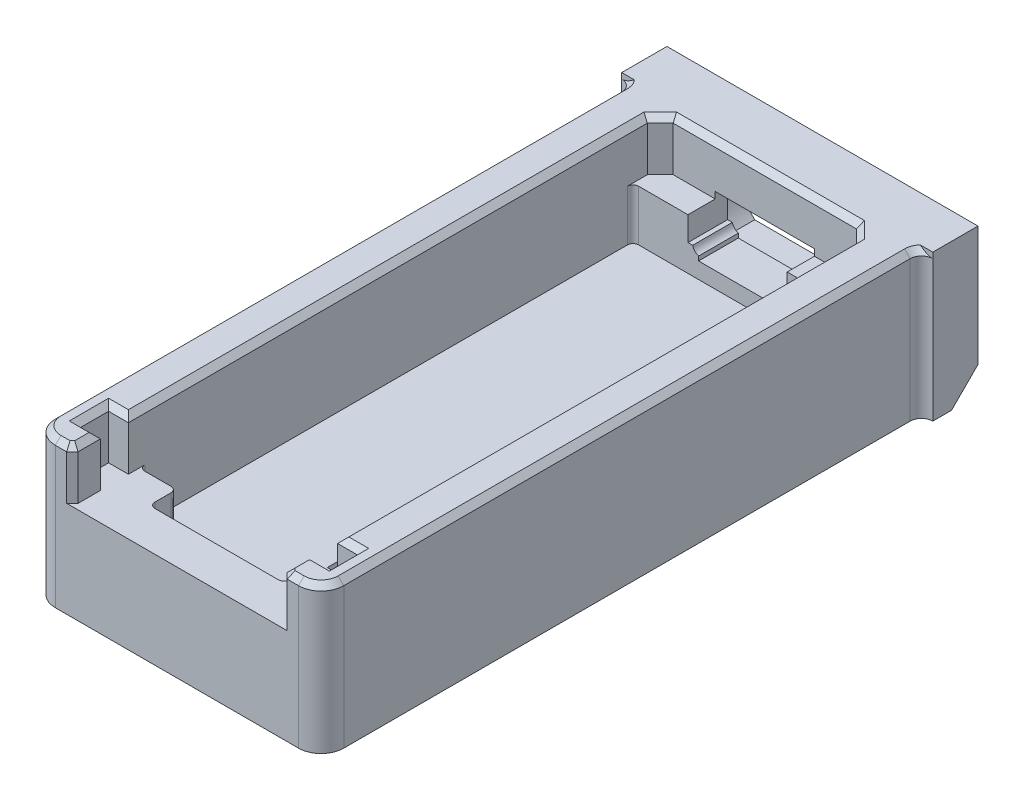
from build123d import *

# Parameters (mm, degrees)
BOSS_EXTRUDE1_DEPTH = 24
SHELL1_T            = -4
FILLET1_R           = 4
CHAMFER1_SIZE       = 2.343145751
SKETCH3_W           = 1
SKETCH3_H           = 1
CUT_EXTRUDE1_DEPTH  = 3.5
CUT_EXTRUDE2_DEPTH  = 4
BOSS_EXTRUDE2_DEPTH = 4.5
BOSS_EXTRUDE5_DEPTH = 3.51
BOSS_EXTRUDE6_DEPTH = 4.45
SKETCH10_W          = 8.78
SKETCH10_H          = 3.872772036
BOSS_EXTRUDE7_DEPTH = 1.1
CHAMFER2_SIZE       = 0.5
SKETCH12_W          = 22.01
SKETCH12_H          = 2.48
CUT_EXTRUDE3_DEPTH  = 4.45
CHAMFER3_SIZE       = 0.5
BOSS_EXTRUDE9_DEPTH = 12.95


with BuildPart() as part:
    # Sketch2 → Boss-Extrude1 (new, symmetric)
    with BuildSketch(Plane(origin=(15.913401445, 30.618542248, 37.090261304), x_dir=(0, 0, 1), z_dir=(1, 0, 0))):
        Polygon((116.226184939, -14.5430724), (116.226184939, 10), (-29.35, 10), (-29.35, -22.172396969), align=None)
    extrude(amount=BOSS_EXTRUDE1_DEPTH, both=True)

    # Shell1
    shell1_openings = [part.faces().sort_by_distance(p)[0] for p in [
        (15.913401445, 48.976276932, 80.528353773),
    ]]
    offset(amount=SHELL1_T, openings=shell1_openings, kind=Kind.INTERSECTION)

    # Fillet1
    fillet1_edges = [part.edges().sort_by_distance(p)[0] for p in [
        (39.913401445, 36.704740732, 7.740261304),
        (-8.086598555, 36.704740732, 7.740261304),
        (-8.086598555, 32.890078447, 153.316446243),
        (39.913401445, 32.890078447, 153.316446243),
    ]]
    fillet(fillet1_edges, radius=FILLET1_R)

    # Chamfer1
    chamfer1_edges = [part.edges().sort_by_distance(p)[0] for p in [
        (15.913401445, 20.618542248, 7.740261304),
        (-8.086598555, 20.618542248, 80.528353773),
        (39.913401445, 20.618542248, 80.528353773),
        (15.913401445, 20.618542248, 153.316446243),
        (38.74182857, 20.618542248, 152.144873368),
        (-6.915025679, 20.618542248, 152.144873368),
        (38.74182857, 20.618542248, 8.911834179),
        (-6.915025679, 20.618542248, 8.911834179),
    ]]
    chamfer(chamfer1_edges, length=CHAMFER1_SIZE)

    # Sketch3 → Cut-Extrude1 (cut)
    with BuildSketch(Plane(origin=(0, 24.618542248, 0), x_dir=(1, 0, 0), z_dir=(0, 1, 0))):
        with Locations((18.603401445, -58.320261304)):
            Rectangle(SKETCH3_W, SKETCH3_H)
        with Locations((21.143401445, -58.320261304)):
            Rectangle(SKETCH3_W, SKETCH3_H)
        with Locations((21.143401445, -55.780261304)):
            Rectangle(SKETCH3_W, SKETCH3_H)
        with Locations((21.143401445, -53.240261304)):
            Rectangle(SKETCH3_W, SKETCH3_H)
        with Locations((18.603401445, -55.780261304)):
            Rectangle(SKETCH3_W, SKETCH3_H)
        with Locations((18.603401445, -53.240261304)):
            Rectangle(SKETCH3_W, SKETCH3_H)
    extrude(amount=-CUT_EXTRUDE1_DEPTH, mode=Mode.SUBTRACT)

    # Sketch4 → Cut-Extrude2 (cut)
    with BuildSketch(Plane(origin=(0, 0, 7.740261304), x_dir=(-1, 0, 0), z_dir=(0, 0, -1))):
        with BuildLine():
            Line((-21.913401445, 31.568542248), (-9.913401445, 31.568542248))
            ThreePointArc((-9.913401445, 31.568542248), (-8.380811265, 27.868542248), (-9.913401445, 24.168542248))
            Line((-9.913401445, 24.168542248), (-21.913401445, 24.168542248))
            ThreePointArc((-21.913401445, 24.168542248), (-23.445991626, 27.868542248), (-21.913401445, 31.568542248))
        make_face()
    extrude(amount=-CUT_EXTRUDE2_DEPTH, mode=Mode.SUBTRACT)

    # Sketch5 → Boss-Extrude2 (add)
    with BuildSketch(Plane(origin=(0, 24.618542248, 0), x_dir=(1, 0, 0), z_dir=(0, 1, 0))):
        with BuildLine():
            Line((11.523401445, -11.740261304), (11.523401445, -15.086474441))
            Line((11.523401445, -15.086474441), (11.523401445, -15.250261304))
            Line((11.523401445, -15.250261304), (7.163401445, -15.250261304))
            ThreePointArc((7.163401445, -15.250261304), (6.809848055, -15.396707913), (6.663401445, -15.750261304))
            Line((6.663401445, -15.750261304), (6.663401445, -58.430261304))
            ThreePointArc((6.663401445, -58.430261304), (6.809848055, -58.783814694), (7.163401445, -58.930261304))
            Line((7.163401445, -58.930261304), (9.463401445, -58.930261304))
            ThreePointArc((9.463401445, -58.930261304), (9.816954836, -59.076707913), (9.963401445, -59.430261304))
            Line((9.963401445, -59.430261304), (9.963401445, -60.840261304))
            ThreePointArc((9.963401445, -60.840261304), (10.109848055, -61.193814694), (10.463401445, -61.340261304))
            Line((10.463401445, -61.340261304), (21.363401445, -61.340261304))
            ThreePointArc((21.363401445, -61.340261304), (21.716954836, -61.193814694), (21.863401445, -60.840261304))
            Line((21.863401445, -60.840261304), (21.863401445, -59.993814694))
            Line((21.863401445, -59.993814694), (22.926954836, -58.930261304))
            Line((22.926954836, -58.930261304), (24.663401445, -58.930261304))
            ThreePointArc((24.663401445, -58.930261304), (25.016954836, -58.783814694), (25.163401445, -58.430261304))
            Line((25.163401445, -58.430261304), (25.163401445, -15.750261304))
            ThreePointArc((25.163401445, -15.750261304), (25.016954836, -15.396707913), (24.663401445, -15.250261304))
            Line((24.663401445, -15.250261304), (20.303401445, -15.250261304))
            Line((20.303401445, -15.250261304), (20.303401445, -15.086474441))
            Line((20.303401445, -15.086474441), (20.303401445, -11.740261304))
            Line((20.303401445, -11.740261304), (29.673401445, -11.740261304))
            ThreePointArc((29.673401445, -11.740261304), (28.966294664, -12.033154523), (28.673401445, -12.740261304))
            Line((28.673401445, -12.740261304), (28.673401445, -62.850261304))
            ThreePointArc((28.673401445, -62.850261304), (28.087615008, -64.264474866), (26.673401445, -64.850261304))
            Line((26.673401445, -64.850261304), (5.153401445, -64.850261304))
            ThreePointArc((5.153401445, -64.850261304), (3.739187883, -64.264474866), (3.153401445, -62.850261304))
            Line((3.153401445, -62.850261304), (3.153401445, -12.740261304))
            ThreePointArc((3.153401445, -12.740261304), (2.860508227, -12.033154523), (2.153401445, -11.740261304))
            Line((2.153401445, -11.740261304), (11.523401445, -11.740261304))
        make_face()
    extrude(amount=BOSS_EXTRUDE2_DEPTH)

    # Sketch7 → Boss-Extrude5 (add)
    with BuildSketch(Plane(origin=(0, 0, 11.740261304), x_dir=(-1, 0, 0), z_dir=(0, 0, -1))):
        with BuildLine():
            Line((-20.303401445, 24.618542248), (-11.523401445, 24.618542248))
            Line((-11.523401445, 24.618542248), (-11.523401445, 26.981314283))
            Line((-11.523401445, 26.981314283), (-11.938804776, 26.981314283))
            ThreePointArc((-11.938804776, 26.981314283), (-12.129593975, 26.634350996), (-12.463401445, 26.421380076))
            Line((-12.463401445, 26.421380076), (-12.463401445, 26.041314283))
            Line((-12.463401445, 26.041314283), (-19.363401445, 26.041314283))
            Line((-19.363401445, 26.041314283), (-19.363401445, 26.421380076))
            ThreePointArc((-19.363401445, 26.421380076), (-19.697208916, 26.634350996), (-19.887998115, 26.981314283))
            Line((-19.887998115, 26.981314283), (-20.303401445, 26.981314283))
            Line((-20.303401445, 26.981314283), (-20.303401445, 24.618542248))
        make_face()
    extrude(amount=-BOSS_EXTRUDE5_DEPTH)

    # Sketch9 → Boss-Extrude6 (add)
    with BuildSketch(Plane(origin=(0, 29.118542248, 0), x_dir=(1, 0, 0), z_dir=(0, 1, 0))):
        with BuildLine():
            Line((28.673401445, -62.850261304), (28.673401445, -12.740261304))
            ThreePointArc((28.673401445, -12.740261304), (28.966294664, -12.033154523), (29.673401445, -11.740261304))
            Line((29.673401445, -11.740261304), (23.294493848, -11.740261304))
            Line((23.294493848, -11.740261304), (20.303401445, -11.740261304))
            Line((20.303401445, -11.740261304), (20.303401445, -12.840261304))
            Line((20.303401445, -12.840261304), (24.016954836, -12.840261304))
            Line((24.016954836, -12.840261304), (25.163401445, -13.986707913))
            Line((25.163401445, -13.986707913), (25.163401445, -60.193814694))
            Line((25.163401445, -60.193814694), (25.163401445, -64.850261304))
            Line((25.163401445, -64.850261304), (26.673401445, -64.850261304))
            ThreePointArc((26.673401445, -64.850261304), (28.087615008, -64.264474866), (28.673401445, -62.850261304))
        make_face()
        with BuildLine():
            Line((11.523401445, -11.740261304), (11.523401445, -12.840261304))
            Line((11.523401445, -12.840261304), (7.809848055, -12.840261304))
            Line((7.809848055, -12.840261304), (6.663401445, -13.986707913))
            Line((6.663401445, -13.986707913), (6.663401445, -60.193814694))
            Line((6.663401445, -60.193814694), (6.663401445, -64.850261304))
            Line((6.663401445, -64.850261304), (5.153401445, -64.850261304))
            ThreePointArc((5.153401445, -64.850261304), (3.739187883, -64.264474866), (3.153401445, -62.850261304))
            Line((3.153401445, -62.850261304), (3.153401445, -12.740261304))
            ThreePointArc((3.153401445, -12.740261304), (2.860508227, -12.033154523), (2.153401445, -11.740261304))
            Line((2.153401445, -11.740261304), (8.532309043, -11.740261304))
            Line((8.532309043, -11.740261304), (11.523401445, -11.740261304))
        make_face()
    extrude(amount=BOSS_EXTRUDE6_DEPTH)

    # Sketch10 → Boss-Extrude7 (add)
    with BuildSketch(Plane(origin=(0, 0, 11.740261304), x_dir=(-1, 0, 0), z_dir=(0, 0, -1))):
        with Locations((-15.913401445, 31.63215623)):
            Rectangle(SKETCH10_W, SKETCH10_H)
    extrude(amount=-BOSS_EXTRUDE7_DEPTH)

    # Chamfer2
    chamfer2_edges = [part.edges().sort_by_distance(p)[0] for p in [
        (6.663401445, 31.343542248, 64.850261304),
        (25.163401445, 31.343542248, 64.850261304),
    ]]
    chamfer(chamfer2_edges, length=CHAMFER2_SIZE)

    # Sketch12 → Cut-Extrude3 (cut)
    with BuildSketch(Plane(origin=(0, 33.568542248, 0), x_dir=(1, 0, 0), z_dir=(0, 1, 0))):
        with Locations((15.913401445, -61.130261304)):
            Rectangle(SKETCH12_W, SKETCH12_H)
    extrude(amount=-CUT_EXTRUDE3_DEPTH, mode=Mode.SUBTRACT)

    # Chamfer3
    # the kernel refuses this chamfer: 0.5 mm, written as the material it takes off along each edge
    with BuildSketch(Plane(origin=(2.153401445, 33.568542248, 12.740261304), x_dir=(1, 0, 0), z_dir=(0, 0, 1))) as chamfer3_piece_1_section:
        Polygon((1, -CHAMFER3_SIZE), (1 + CHAMFER3_SIZE, 0), (1, 0), align=None)
    chamfer3_piece_1 = revolve(axis=Axis((2.153401445, 33.568542248, 12.740261304), (0, 1, 0)), revolution_arc=163.70288589, mode=Mode.PRIVATE)
    chamfer3_piece_1 = split(chamfer3_piece_1, bisect_by=Plane(origin=(2.153401445, 33.568542248, 11.740261304), z_dir=(0, 0, 1)), keep=Keep.TOP, mode=Mode.PRIVATE)
    add(chamfer3_piece_1, mode=Mode.SUBTRACT)
    with BuildSketch(Plane(origin=(3.153401445, 33.568542248, 62.850261304), x_dir=(0, -1, 0), z_dir=(0, 0, -1))) as chamfer3_piece_2:
        Polygon((CHAMFER3_SIZE, 0), (0, -CHAMFER3_SIZE), (0, 0), align=None)
    extrude(amount=50.11, mode=Mode.SUBTRACT)
    with BuildSketch(Plane(origin=(5.153401445, 33.568542248, 62.850261304), x_dir=(0, 0, 1), z_dir=(1, 0, 0))) as chamfer3_piece_3:
        Polygon((2, CHAMFER3_SIZE), (2 - CHAMFER3_SIZE, 0), (2, 0), align=None)
    revolve(axis=Axis((5.153401445, 33.568542248, 62.850261304), (0, -1, 0)), revolution_arc=90, mode=Mode.SUBTRACT)
    with BuildSketch(Plane(origin=(7.449242939, 33.568542248, 64.850261304), x_dir=(0, -1, 0), z_dir=(-1, 0, 0))) as chamfer3_piece_4:
        Polygon((CHAMFER3_SIZE, 0), (0, -CHAMFER3_SIZE), (0, 0), align=None)
    extrude(amount=2.295841494, mode=Mode.SUBTRACT)
    with BuildSketch(Plane(origin=(8.719075295, 33.568542248, 11.931034064), x_dir=(0, -1, 0), z_dir=(-0.70710678118655, -4.937700262164513e-15, 0.707106781186545))) as chamfer3_piece_5_section:
        Polygon((CHAMFER3_SIZE, 0), (0, -CHAMFER3_SIZE), (0, 0), align=None)
    chamfer3_piece_5 = extrude(amount=4.193003332, mode=Mode.PRIVATE)
    chamfer3_piece_5 = split(chamfer3_piece_5, bisect_by=Plane(origin=(8.719075295, 33.568542248, 12.840261304), z_dir=(0, 0, 1)), keep=Keep.TOP, mode=Mode.PRIVATE)
    chamfer3_piece_5 = split(chamfer3_piece_5, bisect_by=Plane(origin=(6.663401445, 33.568542248, 11.931034064), z_dir=(1, 0, 0)), keep=Keep.TOP, mode=Mode.PRIVATE)
    add(chamfer3_piece_5, mode=Mode.SUBTRACT)
    with BuildSketch(Plane(origin=(6.524006561, 33.568542248, 12.840261304), x_dir=(0, -1, 0), z_dir=(1, 0, 0))) as chamfer3_piece_6_section:
        Polygon((CHAMFER3_SIZE, 0), (0, CHAMFER3_SIZE), (0, 0), align=None)
    chamfer3_piece_6 = extrude(amount=18.778789769, mode=Mode.PRIVATE)
    chamfer3_piece_6 = split(chamfer3_piece_6, bisect_by=Plane(origin=(7.166927308, 33.568542248, 13.483182051), z_dir=(0.707106781186545, -4.937700262164548e-15, 0.70710678118655)), keep=Keep.TOP, mode=Mode.PRIVATE)
    chamfer3_piece_6 = split(chamfer3_piece_6, bisect_by=Plane(origin=(15.270480699, 33.568542248, 4.093787166), z_dir=(-0.7071067811865498, -4.937700262164516e-15, 0.7071067811865454)), keep=Keep.TOP, mode=Mode.PRIVATE)
    add(chamfer3_piece_6, mode=Mode.SUBTRACT)
    with BuildSketch(Plane(origin=(29.673401445, 33.568542248, 12.740261304), x_dir=(-1, 0, 0), z_dir=(0, 0, 1))) as chamfer3_piece_7_section:
        Polygon((1, CHAMFER3_SIZE), (1 + CHAMFER3_SIZE, 0), (1, 0), align=None)
    chamfer3_piece_7 = revolve(axis=Axis((29.673401445, 33.568542248, 12.740261304), (0, -1, 0)), revolution_arc=163.70288589, mode=Mode.PRIVATE)
    chamfer3_piece_7 = split(chamfer3_piece_7, bisect_by=Plane(origin=(29.673401445, 33.568542248, 11.740261304), z_dir=(0, 0, 1)), keep=Keep.TOP, mode=Mode.PRIVATE)
    add(chamfer3_piece_7, mode=Mode.SUBTRACT)
    with BuildSketch(Plane(origin=(23.107727596, 33.568542248, 11.931034064), x_dir=(0, -1, 0), z_dir=(0.7071067811865454, -4.9377002621645465e-15, 0.7071067811865498))) as chamfer3_piece_8_section:
        Polygon((CHAMFER3_SIZE, 0), (0, CHAMFER3_SIZE), (0, 0), align=None)
    chamfer3_piece_8 = extrude(amount=4.193003332, mode=Mode.PRIVATE)
    chamfer3_piece_8 = split(chamfer3_piece_8, bisect_by=Plane(origin=(23.107727596, 33.568542248, 12.840261304), z_dir=(0, 0, 1)), keep=Keep.TOP, mode=Mode.PRIVATE)
    chamfer3_piece_8 = split(chamfer3_piece_8, bisect_by=Plane(origin=(25.163401445, 33.568542248, 11.931034064), z_dir=(-1, 0, 0)), keep=Keep.TOP, mode=Mode.PRIVATE)
    add(chamfer3_piece_8, mode=Mode.SUBTRACT)
    with BuildSketch(Plane(origin=(25.163401445, 33.568542248, 61.176102798), x_dir=(0, -1, 0), z_dir=(0, 0, -1))) as chamfer3_piece_9_section:
        Polygon((CHAMFER3_SIZE, 0), (0, -CHAMFER3_SIZE), (0, 0), align=None)
    chamfer3_piece_9 = extrude(amount=48.475236379, mode=Mode.PRIVATE)
    chamfer3_piece_9 = split(chamfer3_piece_9, bisect_by=Plane(origin=(48.758098888, 33.568542248, 37.581405355), z_dir=(-0.7071067811865498, -4.937700262164516e-15, 0.7071067811865454)), keep=Keep.TOP, mode=Mode.PRIVATE)
    add(chamfer3_piece_9, mode=Mode.SUBTRACT)
    with BuildSketch(Plane(origin=(26.673401445, 33.568542248, 62.850261304), x_dir=(0, 0, 1), z_dir=(-1, 0, 0))) as chamfer3_piece_10:
        Polygon((2, -CHAMFER3_SIZE), (2 - CHAMFER3_SIZE, 0), (2, 0), align=None)
    revolve(axis=Axis((26.673401445, 33.568542248, 62.850261304), (0, 1, 0)), revolution_arc=90, mode=Mode.SUBTRACT)
    with BuildSketch(Plane(origin=(28.673401445, 33.568542248, 62.850261304), x_dir=(0, -1, 0), z_dir=(0, 0, -1))) as chamfer3_piece_11:
        Polygon((CHAMFER3_SIZE, 0), (0, CHAMFER3_SIZE), (0, 0), align=None)
    extrude(amount=50.11, mode=Mode.SUBTRACT)
    with BuildSketch(Plane(origin=(6.663401445, 33.568542248, 61.08441981), x_dir=(0, -1, 0), z_dir=(0, 0, 1)), Plane(origin=(25.163401445, 33.568542248, 65.636102798), x_dir=(0, -1, 0), z_dir=(0, 0, -1))) as chamfer3_piece_12:
        Polygon((CHAMFER3_SIZE, 0), (0, -CHAMFER3_SIZE), (0, 0), align=None)
    extrude(amount=4.551682988, mode=Mode.SUBTRACT)
    with BuildSketch(Plane(origin=(24.377559952, 33.568542248, 64.850261304), x_dir=(0, -1, 0), z_dir=(1, 0, 0))) as chamfer3_piece_13:
        Polygon((CHAMFER3_SIZE, 0), (0, CHAMFER3_SIZE), (0, 0), align=None)
    extrude(amount=2.295841494, mode=Mode.SUBTRACT)
    with BuildSketch(Plane(origin=(24.254174206, 33.568542248, 63.441034064), x_dir=(0, -1, 0), z_dir=(0.7071067811865476, -4.9377002621645315e-15, 0.7071067811865476)), Plane(origin=(5.254174206, 33.568542248, 65.759488544), x_dir=(0, -1, 0), z_dir=(0.7071067811865488, 4.937700262164522e-15, -0.7071067811865462))) as chamfer3_piece_14:
        Polygon((CHAMFER3_SIZE, 0), (0, CHAMFER3_SIZE), (0, 0), align=None)
    extrude(amount=3.278789769, mode=Mode.SUBTRACT)
    with BuildSketch(Plane(origin=(6.663401445, 33.568542248, 12.700866419), x_dir=(0, -1, 0), z_dir=(0, 0, 1))) as chamfer3_piece_15_section:
        Polygon((CHAMFER3_SIZE, 0), (0, -CHAMFER3_SIZE), (0, 0), align=None)
    chamfer3_piece_15 = extrude(amount=48.475236379, mode=Mode.PRIVATE)
    chamfer3_piece_15 = split(chamfer3_piece_15, bisect_by=Plane(origin=(7.306322192, 33.568542248, 13.343787166), z_dir=(0.707106781186545, -4.937700262164548e-15, 0.70710678118655)), keep=Keep.TOP, mode=Mode.PRIVATE)
    add(chamfer3_piece_15, mode=Mode.SUBTRACT)
    with BuildSketch(Plane(origin=(23.877559952, 33.568542248, 62.370261304), x_dir=(0, -1, 0), z_dir=(1, 0, 0)), Plane(origin=(7.949242939, 33.568542248, 59.890261304), x_dir=(0, -1, 0), z_dir=(-1, 0, 0)), Plane(origin=(4.908401445, 33.568542248, 62.370261304), x_dir=(0, -1, 0), z_dir=(1, 0, 0)), Plane(origin=(26.918401445, 33.568542248, 59.890261304), x_dir=(0, -1, 0), z_dir=(-1, 0, 0))) as chamfer3_piece_16:
        Polygon((CHAMFER3_SIZE, 0), (0, -CHAMFER3_SIZE), (0, 0), align=None)
    extrude(amount=3.040841494, mode=Mode.SUBTRACT)
    with BuildSketch(Plane(origin=(4.908401445, 33.568542248, 59.890261304), x_dir=(0, -1, 0), z_dir=(0, 0, 1)), Plane(origin=(26.918401445, 33.568542248, 62.370261304), x_dir=(0, -1, 0), z_dir=(0, 0, -1))) as chamfer3_piece_17:
        Polygon((CHAMFER3_SIZE, 0), (0, -CHAMFER3_SIZE), (0, 0), align=None)
    extrude(amount=2.48, mode=Mode.SUBTRACT)
    with BuildSketch(Plane(origin=(6.524006561, 33.568542248, 12.840261304), x_dir=(0, -1, 0), z_dir=(1, 0, 0))) as chamfer3_piece_18a_section:
        Polygon((CHAMFER3_SIZE, 0), (0, CHAMFER3_SIZE), (0, 0), align=None)
    chamfer3_piece_18a = extrude(amount=18.778789769, mode=Mode.PRIVATE)
    chamfer3_piece_18a = split(chamfer3_piece_18a, bisect_by=Plane(origin=(7.166927308, 33.568542248, 13.483182051), z_dir=(-0.707106781186545, 4.937700262164548e-15, -0.70710678118655)), keep=Keep.TOP, mode=Mode.PRIVATE)
    with BuildSketch(Plane(origin=(8.719075295, 33.568542248, 11.931034064), x_dir=(0, -1, 0), z_dir=(-0.70710678118655, -4.937700262164513e-15, 0.707106781186545))) as chamfer3_piece_18b_section:
        Polygon((CHAMFER3_SIZE, 0), (0, -CHAMFER3_SIZE), (0, 0), align=None)
    chamfer3_piece_18b = extrude(amount=4.193003332, mode=Mode.PRIVATE)
    chamfer3_piece_18b = split(chamfer3_piece_18b, bisect_by=Plane(origin=(8.719075295, 33.568542248, 11.740261304), z_dir=(0, 0, 1)), keep=Keep.TOP, mode=Mode.PRIVATE)
    chamfer3_piece_18b = split(chamfer3_piece_18b, bisect_by=Plane(origin=(8.719075295, 33.568542248, 12.840261304), z_dir=(0, 0, -1)), keep=Keep.TOP, mode=Mode.PRIVATE)
    chamfer3_piece_18 = chamfer3_piece_18a & chamfer3_piece_18b
    add(chamfer3_piece_18, mode=Mode.SUBTRACT)
    with BuildSketch(Plane(origin=(6.663401445, 33.568542248, 12.700866419), x_dir=(0, -1, 0), z_dir=(0, 0, 1))) as chamfer3_piece_19a_section:
        Polygon((CHAMFER3_SIZE, 0), (0, -CHAMFER3_SIZE), (0, 0), align=None)
    chamfer3_piece_19a = extrude(amount=47.189394885, mode=Mode.PRIVATE)
    chamfer3_piece_19a = split(chamfer3_piece_19a, bisect_by=Plane(origin=(7.306322192, 33.568542248, 13.343787166), z_dir=(-0.707106781186545, 4.937700262164548e-15, -0.70710678118655)), keep=Keep.TOP, mode=Mode.PRIVATE)
    with BuildSketch(Plane(origin=(8.719075295, 33.568542248, 11.931034064), x_dir=(0, -1, 0), z_dir=(-0.70710678118655, -4.937700262164513e-15, 0.707106781186545))) as chamfer3_piece_19b_section:
        Polygon((CHAMFER3_SIZE, 0), (0, -CHAMFER3_SIZE), (0, 0), align=None)
    chamfer3_piece_19b = extrude(amount=4.193003332, mode=Mode.PRIVATE)
    chamfer3_piece_19b = split(chamfer3_piece_19b, bisect_by=Plane(origin=(6.663401445, 33.568542248, 11.931034064), z_dir=(-1, 0, 0)), keep=Keep.TOP, mode=Mode.PRIVATE)
    chamfer3_piece_19 = chamfer3_piece_19a & chamfer3_piece_19b
    add(chamfer3_piece_19, mode=Mode.SUBTRACT)
    with BuildSketch(Plane(origin=(6.524006561, 33.568542248, 12.840261304), x_dir=(0, -1, 0), z_dir=(1, 0, 0))) as chamfer3_piece_20a_section:
        Polygon((CHAMFER3_SIZE, 0), (0, CHAMFER3_SIZE), (0, 0), align=None)
    chamfer3_piece_20a = extrude(amount=18.778789769, mode=Mode.PRIVATE)
    chamfer3_piece_20a = split(chamfer3_piece_20a, bisect_by=Plane(origin=(15.270480699, 33.568542248, 4.093787166), z_dir=(0.7071067811865498, 4.937700262164516e-15, -0.7071067811865454)), keep=Keep.TOP, mode=Mode.PRIVATE)
    with BuildSketch(Plane(origin=(23.107727596, 33.568542248, 11.931034064), x_dir=(0, -1, 0), z_dir=(0.7071067811865454, -4.9377002621645465e-15, 0.7071067811865498))) as chamfer3_piece_20b_section:
        Polygon((CHAMFER3_SIZE, 0), (0, CHAMFER3_SIZE), (0, 0), align=None)
    chamfer3_piece_20b = extrude(amount=4.193003332, mode=Mode.PRIVATE)
    chamfer3_piece_20b = split(chamfer3_piece_20b, bisect_by=Plane(origin=(23.107727596, 33.568542248, 11.740261304), z_dir=(0, 0, 1)), keep=Keep.TOP, mode=Mode.PRIVATE)
    chamfer3_piece_20b = split(chamfer3_piece_20b, bisect_by=Plane(origin=(23.107727596, 33.568542248, 12.840261304), z_dir=(0, 0, -1)), keep=Keep.TOP, mode=Mode.PRIVATE)
    chamfer3_piece_20 = chamfer3_piece_20a & chamfer3_piece_20b
    add(chamfer3_piece_20, mode=Mode.SUBTRACT)
    with BuildSketch(Plane(origin=(25.163401445, 33.568542248, 59.890261304), x_dir=(0, -1, 0), z_dir=(0, 0, -1))) as chamfer3_piece_21a_section:
        Polygon((CHAMFER3_SIZE, 0), (0, -CHAMFER3_SIZE), (0, 0), align=None)
    chamfer3_piece_21a = extrude(amount=47.189394885, mode=Mode.PRIVATE)
    chamfer3_piece_21a = split(chamfer3_piece_21a, bisect_by=Plane(origin=(48.115178141, 33.568542248, 36.938484608), z_dir=(0.7071067811865498, 4.937700262164516e-15, -0.7071067811865454)), keep=Keep.TOP, mode=Mode.PRIVATE)
    with BuildSketch(Plane(origin=(23.107727596, 33.568542248, 11.931034064), x_dir=(0, -1, 0), z_dir=(0.7071067811865454, -4.9377002621645465e-15, 0.7071067811865498))) as chamfer3_piece_21b_section:
        Polygon((CHAMFER3_SIZE, 0), (0, CHAMFER3_SIZE), (0, 0), align=None)
    chamfer3_piece_21b = extrude(amount=4.193003332, mode=Mode.PRIVATE)
    chamfer3_piece_21b = split(chamfer3_piece_21b, bisect_by=Plane(origin=(25.163401445, 33.568542248, 11.931034064), z_dir=(1, 0, 0)), keep=Keep.TOP, mode=Mode.PRIVATE)
    chamfer3_piece_21 = chamfer3_piece_21a & chamfer3_piece_21b
    add(chamfer3_piece_21, mode=Mode.SUBTRACT)
    with BuildSketch(Plane(origin=(26.918401445, 33.568542248, 63.656102798), x_dir=(0, -1, 0), z_dir=(0, 0, -1))) as chamfer3_piece_22a_section:
        Polygon((CHAMFER3_SIZE, 0), (0, -CHAMFER3_SIZE), (0, 0), align=None)
    chamfer3_piece_22a = extrude(amount=3.765841494, mode=Mode.PRIVATE)
    chamfer3_piece_22a = split(chamfer3_piece_22a, bisect_by=Plane(origin=(26.918401445, 33.568542248, 62.370261304), z_dir=(0, 0, 1)), keep=Keep.TOP, mode=Mode.PRIVATE)
    with BuildSketch(Plane(origin=(25.163401445, 33.568542248, 62.370261304), x_dir=(0, -1, 0), z_dir=(1, 0, 0))) as chamfer3_piece_22b_section:
        Polygon((CHAMFER3_SIZE, 0), (0, -CHAMFER3_SIZE), (0, 0), align=None)
    chamfer3_piece_22b = extrude(amount=3.040841494, mode=Mode.PRIVATE)
    chamfer3_piece_22b = split(chamfer3_piece_22b, bisect_by=Plane(origin=(26.918401445, 33.568542248, 62.370261304), z_dir=(1, 0, 0)), keep=Keep.TOP, mode=Mode.PRIVATE)
    chamfer3_piece_22 = chamfer3_piece_22a & chamfer3_piece_22b
    add(chamfer3_piece_22, mode=Mode.SUBTRACT)
    with BuildSketch(Plane(origin=(6.663401445, 33.568542248, 59.890261304), x_dir=(0, -1, 0), z_dir=(-1, 0, 0))) as chamfer3_piece_23a_section:
        Polygon((CHAMFER3_SIZE, 0), (0, -CHAMFER3_SIZE), (0, 0), align=None)
    chamfer3_piece_23a = extrude(amount=3.040841494, mode=Mode.PRIVATE)
    chamfer3_piece_23a = split(chamfer3_piece_23a, bisect_by=Plane(origin=(4.908401445, 33.568542248, 59.890261304), z_dir=(-1, 0, 0)), keep=Keep.TOP, mode=Mode.PRIVATE)
    with BuildSketch(Plane(origin=(4.908401445, 33.568542248, 58.60441981), x_dir=(0, -1, 0), z_dir=(0, 0, 1))) as chamfer3_piece_23b_section:
        Polygon((CHAMFER3_SIZE, 0), (0, -CHAMFER3_SIZE), (0, 0), align=None)
    chamfer3_piece_23b = extrude(amount=3.765841494, mode=Mode.PRIVATE)
    chamfer3_piece_23b = split(chamfer3_piece_23b, bisect_by=Plane(origin=(4.908401445, 33.568542248, 59.890261304), z_dir=(0, 0, -1)), keep=Keep.TOP, mode=Mode.PRIVATE)
    chamfer3_piece_23 = chamfer3_piece_23a & chamfer3_piece_23b
    add(chamfer3_piece_23, mode=Mode.SUBTRACT)
    with BuildSketch(Plane(origin=(4.908401445, 33.568542248, 59.890261304), x_dir=(0, -1, 0), z_dir=(0, 0, 1))) as chamfer3_piece_24a_section:
        Polygon((CHAMFER3_SIZE, 0), (0, -CHAMFER3_SIZE), (0, 0), align=None)
    chamfer3_piece_24a = extrude(amount=3.765841494, mode=Mode.PRIVATE)
    chamfer3_piece_24a = split(chamfer3_piece_24a, bisect_by=Plane(origin=(4.908401445, 33.568542248, 62.370261304), z_dir=(0, 0, 1)), keep=Keep.TOP, mode=Mode.PRIVATE)
    with BuildSketch(Plane(origin=(3.622559952, 33.568542248, 62.370261304), x_dir=(0, -1, 0), z_dir=(1, 0, 0))) as chamfer3_piece_24b_section:
        Polygon((CHAMFER3_SIZE, 0), (0, -CHAMFER3_SIZE), (0, 0), align=None)
    chamfer3_piece_24b = extrude(amount=3.040841494, mode=Mode.PRIVATE)
    chamfer3_piece_24b = split(chamfer3_piece_24b, bisect_by=Plane(origin=(4.908401445, 33.568542248, 62.370261304), z_dir=(-1, 0, 0)), keep=Keep.TOP, mode=Mode.PRIVATE)
    chamfer3_piece_24 = chamfer3_piece_24a & chamfer3_piece_24b
    add(chamfer3_piece_24, mode=Mode.SUBTRACT)
    with BuildSketch(Plane(origin=(28.204242939, 33.568542248, 59.890261304), x_dir=(0, -1, 0), z_dir=(-1, 0, 0))) as chamfer3_piece_25a_section:
        Polygon((CHAMFER3_SIZE, 0), (0, -CHAMFER3_SIZE), (0, 0), align=None)
    chamfer3_piece_25a = extrude(amount=3.040841494, mode=Mode.PRIVATE)
    chamfer3_piece_25a = split(chamfer3_piece_25a, bisect_by=Plane(origin=(26.918401445, 33.568542248, 59.890261304), z_dir=(1, 0, 0)), keep=Keep.TOP, mode=Mode.PRIVATE)
    with BuildSketch(Plane(origin=(26.918401445, 33.568542248, 62.370261304), x_dir=(0, -1, 0), z_dir=(0, 0, -1))) as chamfer3_piece_25b_section:
        Polygon((CHAMFER3_SIZE, 0), (0, -CHAMFER3_SIZE), (0, 0), align=None)
    chamfer3_piece_25b = extrude(amount=3.765841494, mode=Mode.PRIVATE)
    chamfer3_piece_25b = split(chamfer3_piece_25b, bisect_by=Plane(origin=(26.918401445, 33.568542248, 59.890261304), z_dir=(0, 0, -1)), keep=Keep.TOP, mode=Mode.PRIVATE)
    chamfer3_piece_25 = chamfer3_piece_25a & chamfer3_piece_25b
    add(chamfer3_piece_25, mode=Mode.SUBTRACT)


with BuildPart() as body_2:
    # Sketch13 → Boss-Extrude9 (new body)
    with BuildSketch(Plane(origin=(0, 33.568542248, 0), x_dir=(1, 0, 0), z_dir=(0, 1, 0))):
        with BuildLine():
            Line((2.153401445, -11.740261304), (2.153401445, -7.740261304))
            Line((2.153401445, -7.740261304), (29.673401445, -7.740261304))
            Line((29.673401445, -7.740261304), (29.673401445, -11.740261304))
            ThreePointArc((29.673401445, -11.740261304), (28.966294664, -12.033154523), (28.673401445, -12.740261304))
            Line((28.673401445, -12.740261304), (28.673401445, -62.850261304))
            ThreePointArc((28.673401445, -62.850261304), (28.087615008, -64.264474866), (26.673401445, -64.850261304))
            Line((26.673401445, -64.850261304), (5.153401445, -64.850261304))
            ThreePointArc((5.153401445, -64.850261304), (3.739187883, -64.264474866), (3.153401445, -62.850261304))
            Line((3.153401445, -62.850261304), (3.153401445, -12.740261304))
            ThreePointArc((3.153401445, -12.740261304), (2.860508227, -12.033154523), (2.153401445, -11.740261304))
        make_face()
    extrude(amount=-BOSS_EXTRUDE9_DEPTH)


with BuildPart() as part_1:
    add(part.part)

    # Combine1: intersect body 2
    add(body_2.part, mode=Mode.INTERSECT)


solid = part_1.part
